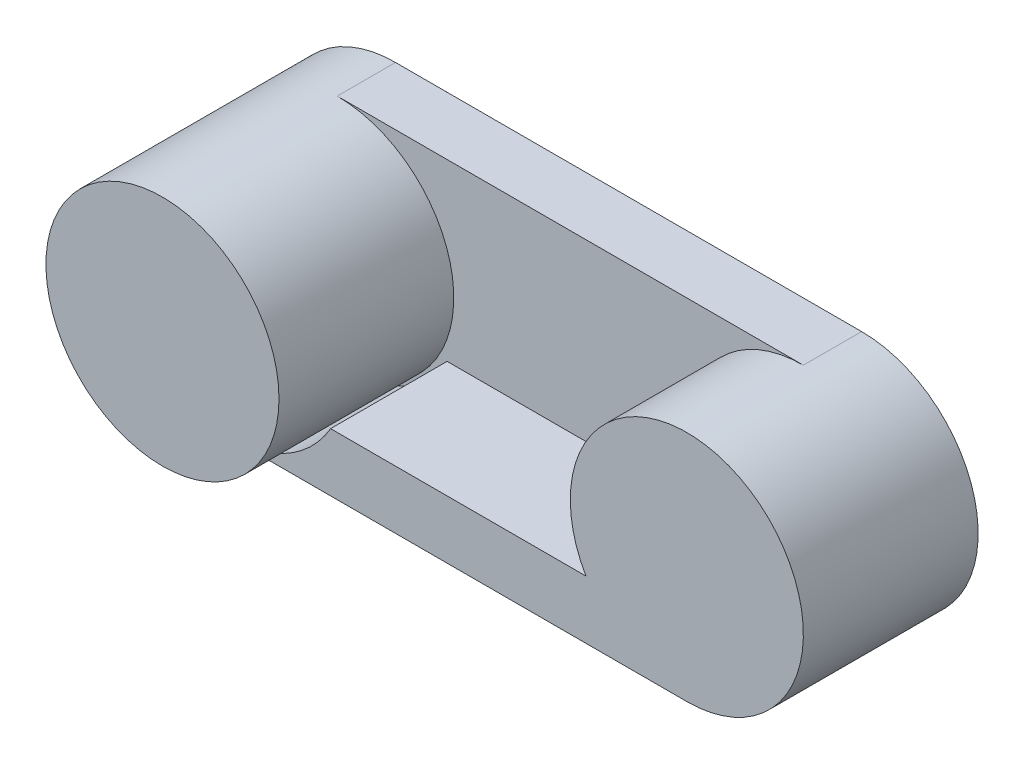
from build123d import *

# Parameters (mm, degrees)
BOSS_EXTRUDE2_DEPTH = 10
SKETCH3_R           = 20
BOSS_EXTRUDE3_DEPTH = 30
BOSS_EXTRUDE5_DEPTH = 20


with BuildPart() as part:
    # Sketch1 → Boss-Extrude2 (new body)
    with BuildSketch(Plane.XY):
        with BuildLine():
            Line((-49.388560158, 20), (30.611439842, 20))
            ThreePointArc((30.611439842, 20), (50.611439842, 0), (30.611439842, -20))
            Line((30.611439842, -20), (-49.388560158, -20))
            ThreePointArc((-49.388560158, -20), (-69.388560158, 0), (-49.388560158, 20))
        make_face()
    extrude(amount=BOSS_EXTRUDE2_DEPTH)

    # Sketch3 → Boss-Extrude3 (add)
    with BuildSketch(Plane.XY.offset(10)):
        with Locations((-49.388560158, 0)):
            Circle(SKETCH3_R)
    extrude(amount=BOSS_EXTRUDE3_DEPTH)


with BuildPart() as body_2:
    # Sketch4 → Boss-Extrude5 (new body)
    with BuildSketch(Plane.XY.offset(10)):
        with BuildLine():
            Line((30.611439842, -20), (-47.852730536, -20))
            ThreePointArc((-47.852730536, -20), (-37.852730536, -17.320508076), (-30.53222246, -10))
            Line((-30.53222246, -10), (13.290931767, -10))
            ThreePointArc((13.290931767, -10), (40.611439842, 17.320508076), (30.611439842, -20))
        make_face()
    extrude(amount=BOSS_EXTRUDE5_DEPTH)


with BuildPart() as part_1:
    add(part.part)

    # Combine4: union body 2
    add(body_2.part)


solid = part_1.part
